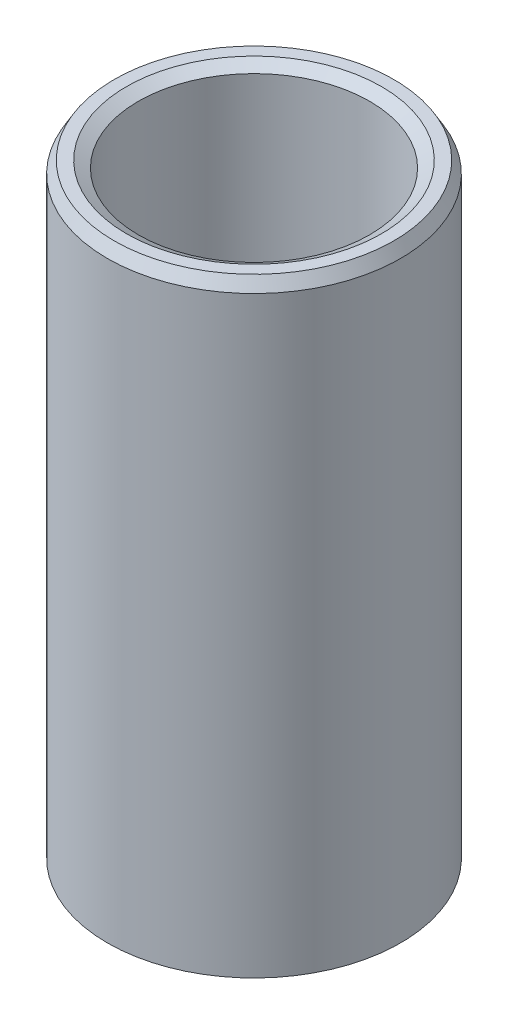
from build123d import *
from OCP.BRepFilletAPI import BRepFilletAPI_MakeChamfer

# Parameters (mm, degrees)
SKETCH1_R           = 20
BOSS_EXTRUDE1_DEPTH = 83.382836548
SKETCH2_R           = 15.776816103
CUT_EXTRUDE1_DEPTH  = 89.049403353
CHAMFER1_SIZE       = 1.612475349
CHAMFER1_SIZE2      = 0.930963077


with BuildPart() as part:
    # Sketch1 → Boss-Extrude1 (new body)
    with BuildSketch(Plane(origin=(0, 0, 0), x_dir=(1, 0, 0), z_dir=(0, 1, 0))):
        Circle(SKETCH1_R)
    extrude(amount=BOSS_EXTRUDE1_DEPTH)

    # Sketch2 → Cut-Extrude1 (cut, through all)
    with BuildSketch(Plane(origin=(0, 0, 0), x_dir=(1, 0, 0), z_dir=(0, 1, 0))):
        Circle(SKETCH2_R)
    extrude(amount=CUT_EXTRUDE1_DEPTH, mode=Mode.SUBTRACT)

    # Chamfer1: one chamfer whose edges measure the first distance from different faces: ONE call of the kernel's chamfer builder (chamfer() names one face for all edges)
    chamfer1_edges_1 = [part.edges().sort_by_distance(p)[0] for p in [
        (-15.776816103, 83.382836548, 0),
    ]]
    chamfer1_side_1 = [part.faces().sort_by_distance(p)[0] for p in [
        (-19.434314575, 83.382836548, 0),
    ]]
    chamfer1_edges_2 = [part.edges().sort_by_distance(p)[0] for p in [
        (-15.776816103, 0, 0),
    ]]
    chamfer1_side_2 = [part.faces().sort_by_distance(p)[0] for p in [
        (-15.776816103, 41.691418274, 0),
    ]]
    chamfer1_edges_3 = [part.edges().sort_by_distance(p)[0] for p in [
        (-20, 0, 0),
    ]]
    chamfer1_side_3 = [part.faces().sort_by_distance(p)[0] for p in [
        (-19.434314575, 0, 0),
    ]]
    chamfer1_edges_4 = [part.edges().sort_by_distance(p)[0] for p in [
        (-20, 83.382836548, 0),
    ]]
    chamfer1_side_4 = [part.faces().sort_by_distance(p)[0] for p in [
        (-20, 41.691418274, 0),
    ]]
    chamfer1 = BRepFilletAPI_MakeChamfer(part.part.solid().wrapped)
    for e in chamfer1_edges_1:
        chamfer1.Add(CHAMFER1_SIZE, CHAMFER1_SIZE2, e.wrapped, chamfer1_side_1[0].wrapped)  # the first distance lies on this face
    for e in chamfer1_edges_2:
        chamfer1.Add(CHAMFER1_SIZE, CHAMFER1_SIZE2, e.wrapped, chamfer1_side_2[0].wrapped)  # the first distance lies on this face
    for e in chamfer1_edges_3:
        chamfer1.Add(CHAMFER1_SIZE, CHAMFER1_SIZE2, e.wrapped, chamfer1_side_3[0].wrapped)  # the first distance lies on this face
    for e in chamfer1_edges_4:
        chamfer1.Add(CHAMFER1_SIZE, CHAMFER1_SIZE2, e.wrapped, chamfer1_side_4[0].wrapped)  # the first distance lies on this face
    add(Compound.cast(chamfer1.Shape()), mode=Mode.REPLACE)


solid = part.part
